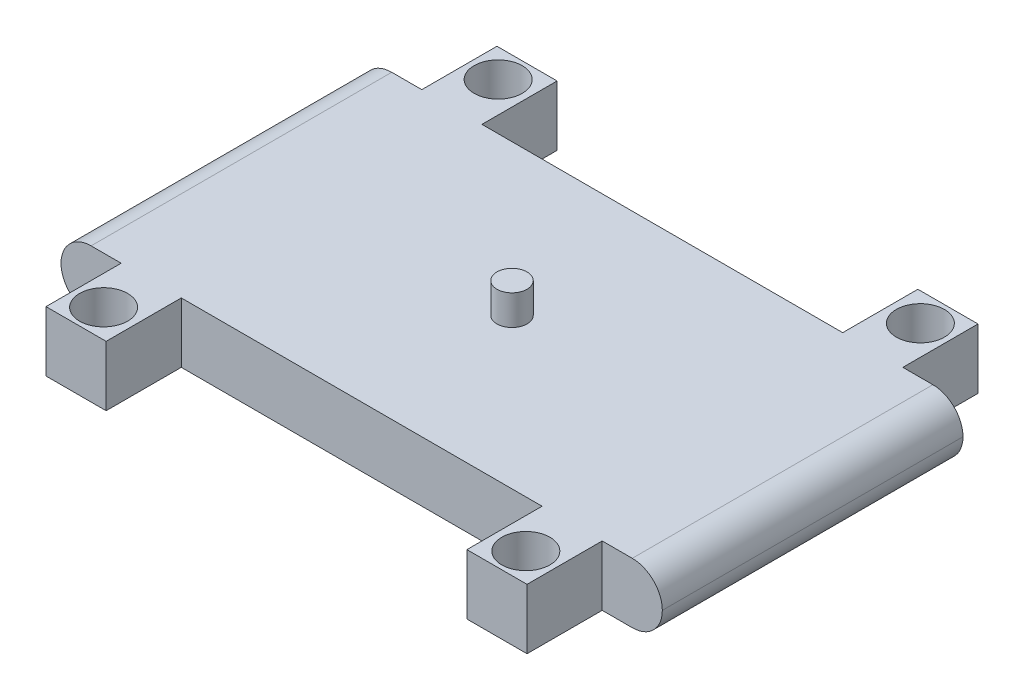
from build123d import *

# Parameters (mm, degrees)
SKETCH1_W           = 200
SKETCH1_H           = 100
BOSS_EXTRUDE1_DEPTH = 20
SKETCH2_W           = 20
SKETCH2_H           = 20
BOSS_EXTRUDE2_DEPTH = 75
SKETCH3_W           = 20
SKETCH3_H           = 20
BOSS_EXTRUDE3_DEPTH = 75
SKETCH4_R           = 8
CUT_EXTRUDE1_DEPTH  = 150
SKETCH5_R           = 5
BOSS_EXTRUDE4_DEPTH = 30
FILLET3_R           = 10
FILLET4_R           = 10


with BuildPart() as part:
    # Sketch1 → Boss-Extrude1 (new body)
    with BuildSketch(Plane(origin=(0, 0, 0), x_dir=(1, 0, 0), z_dir=(0, 1, 0))):
        Rectangle(SKETCH1_W, SKETCH1_H)
    extrude(amount=BOSS_EXTRUDE1_DEPTH)

    # Sketch2 → Boss-Extrude2 (add, symmetric)
    with BuildSketch(Plane.XY):
        with Locations((-70, 10)):
            Rectangle(SKETCH2_W, SKETCH2_H)
    extrude(amount=BOSS_EXTRUDE2_DEPTH, both=True)

    # Sketch3 → Boss-Extrude3 (add, symmetric)
    with BuildSketch(Plane.XY):
        with Locations((70, 10)):
            Rectangle(SKETCH3_W, SKETCH3_H)
    extrude(amount=BOSS_EXTRUDE3_DEPTH, both=True)

    # Sketch4 → Cut-Extrude1 (cut)
    with BuildSketch(Plane(origin=(0, 0, 0), x_dir=(1, 0, 0), z_dir=(0, 1, 0))):
        with Locations(Location((-70.221727327, 65.616664793, 0), (0, 0, 270))):
            Circle(SKETCH4_R)
        with Locations(Location((70.221727327, 65.616664793, 0), (0, 0, 270))):
            Circle(SKETCH4_R)
        with Locations(Location((-70.221727327, -65.616664793, 0), (0, 0, 270))):
            Circle(SKETCH4_R)
        with Locations(Location((70.221727327, -65.616664793, 0), (0, 0, 270))):
            Circle(SKETCH4_R)
    extrude(amount=CUT_EXTRUDE1_DEPTH, mode=Mode.SUBTRACT)

    # Sketch5 → Boss-Extrude4 (add)
    with BuildSketch(Plane(origin=(0, 0, 0), x_dir=(1, 0, 0), z_dir=(0, 1, 0))):
        with Locations(Location((0, 0, 0), (0, 0, 270))):
            Circle(SKETCH5_R)
    extrude(amount=BOSS_EXTRUDE4_DEPTH)

    # Fillet3
    fillet3_edges = [part.edges().sort_by_distance(p)[0] for p in [
        (100, 0, 0),
        (100, 20, 0),
    ]]
    fillet(fillet3_edges, radius=FILLET3_R - 0.0001)  # a hair under: the kernel refuses the full size

    # Fillet4
    fillet4_edges = [part.edges().sort_by_distance(p)[0] for p in [
        (-100, 0, 0),
        (-100, 20, 0),
    ]]
    fillet(fillet4_edges, radius=FILLET4_R - 0.0001)  # a hair under: the kernel refuses the full size


solid = part.part
